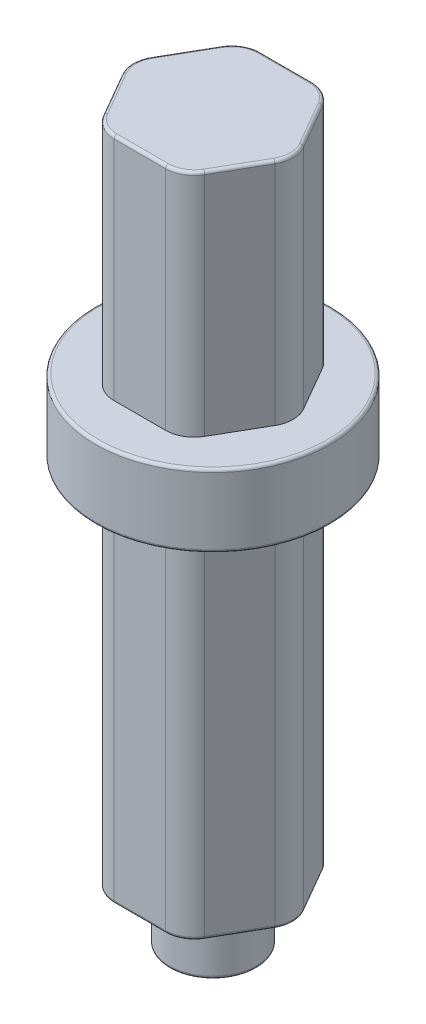
from build123d import *

# Parameters (mm, degrees)
SKETCH1_R             = 3.8
MOTORMOUNTSHELL_DEPTH = 5.08
MOTORMOUNT_DEPTH      = 5.08
SHAFT_DEPTH           = 58
SKETCH4_W             = 10.25
SKETCH4_H             = 6.35
SKETCH5_R             = 0.005
MOUNTROUND_DEPTH      = 5.08
FILLET1_R             = 0.254
FILLET2_R             = 2.5


with BuildPart() as part:
    # Sketch1 → MotorMountShell (new body)
    with BuildSketch(Plane(origin=(0, 0, 0), x_dir=(1, 0, 0), z_dir=(0, 1, 0))):
        with Locations(Location((0, 0, 0), (0, 0, 270))):
            Circle(SKETCH1_R)
    extrude(amount=MOTORMOUNTSHELL_DEPTH)

    # Sketch2 → MotorMount (cut)
    with BuildSketch(Plane.XZ):
        with BuildLine():
            ThreePointArc((1.45, 1.91245915), (0, 2.4), (-1.45, 1.91245915))
            Line((-1.45, 1.91245915), (-1.45, -1.91245915))
            ThreePointArc((-1.45, -1.91245915), (0, -2.4), (1.45, -1.91245915))
            Line((1.45, -1.91245915), (1.45, 1.91245915))
        make_face()
    extrude(amount=-MOTORMOUNT_DEPTH, mode=Mode.SUBTRACT)

    # Sketch3 → Shaft (add)
    with BuildSketch(Plane(origin=(0, 5.08, 0), x_dir=(1, 0, 0), z_dir=(0, 1, 0))):
        Polygon((3.680607966, -6.375), (7.361215932, 0), (3.680607966, 6.375), (-3.680607966, 6.375), (-7.361215932, 0), (-3.680607966, -6.375), align=None)
    extrude(amount=SHAFT_DEPTH)

    # Sketch4 → Collar (revolve)
    with BuildSketch(Plane.XY, mode=Mode.PRIVATE) as collar_sk:
        with Locations((5.125, 39.905)):
            Rectangle(SKETCH4_W, SKETCH4_H)
    revolve(collar_sk.sketch.rotate(Axis((0, 0, 0), (0, 1, 0)), 90), axis=Axis((0, 0, 0), (0, 1, 0)))

    # Sketch5 → MountRound (cut)
    with BuildSketch(Plane.XZ):
        with Locations((-1.45, 1.91245915)):
            Circle(SKETCH5_R)
        with Locations((1.45, 1.91245915)):
            Circle(SKETCH5_R)
        with Locations((-1.45, -1.91245915)):
            Circle(SKETCH5_R)
        with Locations((1.45, -1.91245915)):
            Circle(SKETCH5_R)
    extrude(amount=-MOUNTROUND_DEPTH, mode=Mode.SUBTRACT)

    # Fillet1
    fillet1_edges = [part.edges().sort_by_distance(p)[0] for p in [
        (0, 0, -3.8),
        (0, 5.08, 6.375),
        (5.520911949, 5.08, 3.1875),
        (5.520911949, 5.08, -3.1875),
        (0, 5.08, -6.375),
        (-5.520911949, 5.08, -3.1875),
        (-5.520911949, 5.08, 3.1875),
        (0, 63.08, 6.375),
        (5.520911949, 63.08, 3.1875),
        (5.520911949, 63.08, -3.1875),
        (0, 63.08, -6.375),
        (-5.520911949, 63.08, -3.1875),
        (-5.520911949, 63.08, 3.1875),
        (0, 5.08, -3.8),
        (0, 36.73, 10.25),
        (0, 43.08, 10.25),
    ]]
    fillet(fillet1_edges, radius=FILLET1_R)

    # Fillet2
    # the kernel refuses this fillet: 2.5 mm, written as the material it takes off along each edge
    with BuildSketch(Plane(origin=(-4.474464586, 5.08, 0), x_dir=(-0.8660254037844387, 0, 0.49999999999999994), z_dir=(0.49999999999999994, 0, 0.8660254037844387))) as fillet2_piece_1:
        with BuildLine():
            CenterArc((2.246, -0.254), 0.254, 0, 90)
            Line((2.5, -0.254), (2.5, 0))
            Line((2.5, 0), (2.246, 0))
        make_face()
    revolve(axis=Axis((-4.474464586, 5.08, 0), (0, -1, 0)), revolution_arc=60, mode=Mode.SUBTRACT)
    with BuildSketch(Plane(origin=(-2.237232293, 5.08, -3.875), x_dir=(-0.8660254037844387, 0, -0.5000000000000001), z_dir=(-0.5000000000000001, 0, 0.8660254037844387))) as fillet2_piece_2:
        with BuildLine():
            CenterArc((2.246, -0.254), 0.254, 0, 90)
            Line((2.5, -0.254), (2.5, 0))
            Line((2.5, 0), (2.246, 0))
        make_face()
    revolve(axis=Axis((-2.237232293, 5.08, -3.875), (0, -1, 0)), revolution_arc=60, mode=Mode.SUBTRACT)
    with BuildSketch(Plane(origin=(-2.237232293, 5.08, 3.875), x_dir=(0, 0, 1), z_dir=(1, 0, 0))) as fillet2_piece_3:
        with BuildLine():
            CenterArc((2.246, -0.254), 0.254, 0, 90)
            Line((2.5, -0.254), (2.5, 0))
            Line((2.5, 0), (2.246, 0))
        make_face()
    revolve(axis=Axis((-2.237232293, 5.08, 3.875), (0, -1, 0)), revolution_arc=60, mode=Mode.SUBTRACT)
    with BuildSketch(Plane(origin=(2.237232293, 5.08, -3.875), x_dir=(0, 0, -1), z_dir=(-1, 0, 0))) as fillet2_piece_4:
        with BuildLine():
            CenterArc((2.246, -0.254), 0.254, 0, 90)
            Line((2.5, -0.254), (2.5, 0))
            Line((2.5, 0), (2.246, 0))
        make_face()
    revolve(axis=Axis((2.237232293, 5.08, -3.875), (0, -1, 0)), revolution_arc=60, mode=Mode.SUBTRACT)
    with BuildSketch(Plane(origin=(2.237232293, 5.08, 3.875), x_dir=(0.8660254037844388, 0, 0.4999999999999999), z_dir=(0.4999999999999999, 0, -0.8660254037844388))) as fillet2_piece_5:
        with BuildLine():
            CenterArc((2.246, -0.254), 0.254, 0, 90)
            Line((2.5, -0.254), (2.5, 0))
            Line((2.5, 0), (2.246, 0))
        make_face()
    revolve(axis=Axis((2.237232293, 5.08, 3.875), (0, -1, 0)), revolution_arc=60, mode=Mode.SUBTRACT)
    with BuildSketch(Plane(origin=(4.474464586, 5.08, 0), x_dir=(0.8660254037844387, 0, -0.49999999999999994), z_dir=(-0.49999999999999994, 0, -0.8660254037844387))) as fillet2_piece_6:
        with BuildLine():
            CenterArc((2.246, -0.254), 0.254, 0, 90)
            Line((2.5, -0.254), (2.5, 0))
            Line((2.5, 0), (2.246, 0))
        make_face()
    revolve(axis=Axis((4.474464586, 5.08, 0), (0, -1, 0)), revolution_arc=60, mode=Mode.SUBTRACT)
    with BuildSketch(Plane(origin=(2.237232293, 63.08, -3.875), x_dir=(0.8660254037844387, 0, -0.49999999999999994), z_dir=(0.49999999999999994, 0, 0.8660254037844387))) as fillet2_piece_7:
        with BuildLine():
            CenterArc((2.246, -0.254), 0.254, 0, 90)
            Line((2.5, -0.254), (2.5, 0))
            Line((2.5, 0), (2.246, 0))
        make_face()
    revolve(axis=Axis((2.237232293, 63.08, -3.875), (0, 1, 0)), revolution_arc=60, mode=Mode.SUBTRACT)
    with BuildSketch(Plane(origin=(4.474464586, 63.08, 0), x_dir=(0.8660254037844388, 0, 0.4999999999999999), z_dir=(-0.4999999999999999, 0, 0.8660254037844388))) as fillet2_piece_8:
        with BuildLine():
            CenterArc((2.246, -0.254), 0.254, 0, 90)
            Line((2.5, -0.254), (2.5, 0))
            Line((2.5, 0), (2.246, 0))
        make_face()
    revolve(axis=Axis((4.474464586, 63.08, 0), (0, 1, 0)), revolution_arc=60, mode=Mode.SUBTRACT)
    with BuildSketch(Plane(origin=(-2.237232293, 63.08, -3.875), x_dir=(0, 0, -1), z_dir=(1, 0, 0))) as fillet2_piece_9:
        with BuildLine():
            CenterArc((2.246, -0.254), 0.254, 0, 90)
            Line((2.5, -0.254), (2.5, 0))
            Line((2.5, 0), (2.246, 0))
        make_face()
    revolve(axis=Axis((-2.237232293, 63.08, -3.875), (0, 1, 0)), revolution_arc=60, mode=Mode.SUBTRACT)
    with BuildSketch(Plane(origin=(2.237232293, 63.08, 3.875), x_dir=(0, 0, 1), z_dir=(-1, 0, 0))) as fillet2_piece_10:
        with BuildLine():
            CenterArc((2.246, -0.254), 0.254, 0, 90)
            Line((2.5, -0.254), (2.5, 0))
            Line((2.5, 0), (2.246, 0))
        make_face()
    revolve(axis=Axis((2.237232293, 63.08, 3.875), (0, 1, 0)), revolution_arc=60, mode=Mode.SUBTRACT)
    with BuildSketch(Plane(origin=(-4.474464586, 63.08, 0), x_dir=(-0.8660254037844387, 0, -0.5000000000000001), z_dir=(0.5000000000000001, 0, -0.8660254037844387))) as fillet2_piece_11:
        with BuildLine():
            CenterArc((2.246, -0.254), 0.254, 0, 90)
            Line((2.5, -0.254), (2.5, 0))
            Line((2.5, 0), (2.246, 0))
        make_face()
    revolve(axis=Axis((-4.474464586, 63.08, 0), (0, 1, 0)), revolution_arc=60, mode=Mode.SUBTRACT)
    with BuildSketch(Plane(origin=(-2.237232293, 63.08, 3.875), x_dir=(-0.8660254037844387, 0, 0.49999999999999994), z_dir=(-0.49999999999999994, 0, -0.8660254037844387))) as fillet2_piece_12:
        with BuildLine():
            CenterArc((2.246, -0.254), 0.254, 0, 90)
            Line((2.5, -0.254), (2.5, 0))
            Line((2.5, 0), (2.246, 0))
        make_face()
    revolve(axis=Axis((-2.237232293, 63.08, 3.875), (0, 1, 0)), revolution_arc=60, mode=Mode.SUBTRACT)
    with BuildSketch(Plane(origin=(-7.361215932, 43.08, 0), x_dir=(0.5000000000000007, 0, -0.8660254037844383), z_dir=(0, 1, 0)), Plane(origin=(-3.680607966, 43.08, 6.375), x_dir=(-0.4999999999999998, 0, -0.8660254037844387), z_dir=(0, 1, 0)), Plane(origin=(-3.680607966, 43.08, -6.375), x_dir=(1, 0, 0), z_dir=(0, 1, 0)), Plane(origin=(3.680607966, 43.08, -6.375), x_dir=(0.4999999999999998, 0, 0.8660254037844387), z_dir=(0, 1, 0)), Plane(origin=(7.361215932, 43.08, 0), x_dir=(-0.49999999999999933, 0, 0.8660254037844389), z_dir=(0, 1, 0))) as fillet2_piece_13:
        with BuildLine():
            CenterArc((FILLET2_R * 0.57735026919, -FILLET2_R), FILLET2_R, 90, 60)
            Line((-FILLET2_R * 0.288675134595, -FILLET2_R * 0.5), (0, 0))
            Line((0, 0), (FILLET2_R * 0.57735026919, 0))
        make_face()
    extrude(amount=20, mode=Mode.SUBTRACT)
    with BuildSketch(Plane(origin=(3.680607966, 43.08, 6.375), x_dir=(0.49999999999999956, 0, -0.8660254037844389), z_dir=(0, 1, 0))) as fillet2_piece_14:
        with BuildLine():
            CenterArc((FILLET2_R * 0.57735026919, FILLET2_R), FILLET2_R, 210, 60)
            Line((-FILLET2_R * 0.288675134595, FILLET2_R * 0.5), (0, 0))
            Line((0, 0), (FILLET2_R * 0.57735026919, 0))
        make_face()
    extrude(amount=20, mode=Mode.SUBTRACT)
    with BuildSketch(Plane(origin=(-3.680607966, 5.08, 6.375), x_dir=(1, 0, 0), z_dir=(0, 1, 0)), Plane(origin=(-7.361215932, 5.08, 0), x_dir=(0.4999999999999998, 0, 0.8660254037844387), z_dir=(0, 1, 0)), Plane(origin=(3.680607966, 5.08, 6.375), x_dir=(0.49999999999999956, 0, -0.8660254037844389), z_dir=(0, 1, 0))) as fillet2_piece_15:
        with BuildLine():
            CenterArc((FILLET2_R * 0.57735026919, FILLET2_R), FILLET2_R, 210, 60)
            Line((-FILLET2_R * 0.288675134595, FILLET2_R * 0.5), (0, 0))
            Line((0, 0), (FILLET2_R * 0.57735026919, 0))
        make_face()
    extrude(amount=31.65, mode=Mode.SUBTRACT)
    with BuildSketch(Plane(origin=(-3.680607966, 5.08, -6.375), x_dir=(1, 0, 0), z_dir=(0, 1, 0)), Plane(origin=(3.680607966, 5.08, -6.375), x_dir=(0.4999999999999998, 0, 0.8660254037844387), z_dir=(0, 1, 0)), Plane(origin=(7.361215932, 5.08, 0), x_dir=(-0.5000000000000003, 0, 0.8660254037844384), z_dir=(0, 1, 0))) as fillet2_piece_16:
        with BuildLine():
            CenterArc((FILLET2_R * 0.57735026919, -FILLET2_R), FILLET2_R, 90, 60)
            Line((-FILLET2_R * 0.288675134595, -FILLET2_R * 0.5), (0, 0))
            Line((0, 0), (FILLET2_R * 0.57735026919, 0))
        make_face()
    extrude(amount=31.65, mode=Mode.SUBTRACT)


solid = part.part
